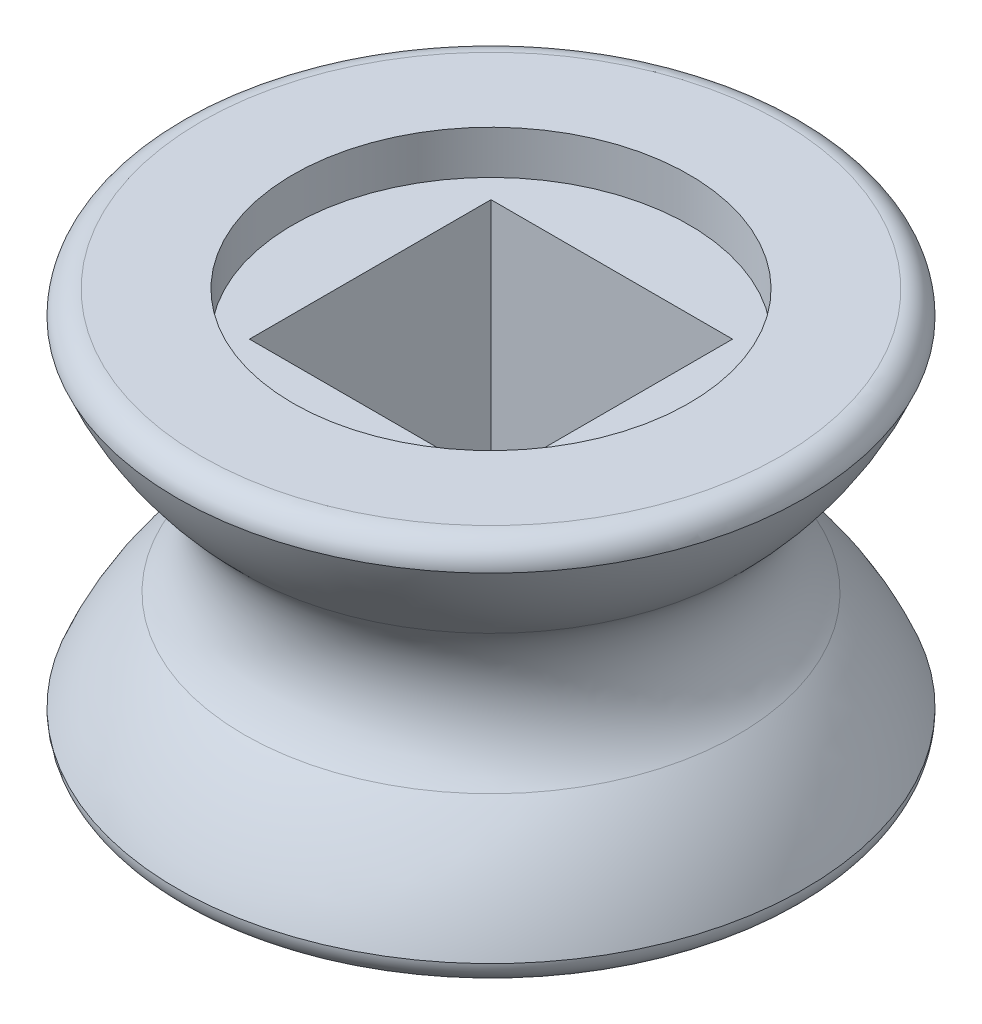
from build123d import *

# Parameters (mm, degrees)
SKETCH3_W          = 6.35
SKETCH3_H          = 6.35
CUT_EXTRUDE2_DEPTH = 16.476293161
SKETCH4_R          = 5.207
CUT_EXTRUDE3_DEPTH = 1.143
FILLET1_R          = 0.635
FILLET2_R          = 7.62


with BuildPart() as part:
    # Sketch1 → Revolve1 (revolve)
    with BuildSketch(Plane.XY, mode=Mode.PRIVATE) as revolve1_sk:
        with BuildLine():
            Line((8.255, -2.54), (8.255, -5.08))
            Line((8.255, -5.08), (0, -5.08))
            Line((0, -5.08), (0, 5.08))
            Line((0, 5.08), (8.255, 5.08))
            Line((8.255, 5.08), (8.255, 2.54))
            ThreePointArc((8.255, 2.54), (5.715, 0), (8.255, -2.54))
        make_face()
    revolve(revolve1_sk.sketch.rotate(Axis((0, -5.08, 0), (0, 1, 0)), 90), axis=Axis((0, -5.08, 0), (0, 1, 0)))

    # Sketch3 → Cut-Extrude2 (cut, through all)
    with BuildSketch(Plane(origin=(0, 5.08, 0), x_dir=(1, 0, 0), z_dir=(0, 1, 0))):
        Rectangle(SKETCH3_W, SKETCH3_H)
    extrude(amount=-CUT_EXTRUDE2_DEPTH, mode=Mode.SUBTRACT)

    # Sketch4 → Cut-Extrude3 (cut)
    with BuildSketch(Plane(origin=(0, 5.08, 0), x_dir=(1, 0, 0), z_dir=(0, 1, 0))):
        with Locations(Location((0, 0, 0), (0, 0, 270))):
            Circle(SKETCH4_R)
    cut_extrude3 = extrude(amount=-CUT_EXTRUDE3_DEPTH, mode=Mode.SUBTRACT)

    # Mirror1: Cut-Extrude3 across plane
    add(cut_extrude3.mirror(Plane.ZX), mode=Mode.SUBTRACT)

    # Fillet1
    fillet1_edges = [part.edges().sort_by_distance(p)[0] for p in [
        (0, 5.08, 8.255),
        (0, -5.08, 8.255),
    ]]
    fillet(fillet1_edges, radius=FILLET1_R)

    # Fillet2
    # the kernel refuses this fillet: 7.62 mm, written as the material it takes off along each edge
    with BuildSketch(Plane(origin=(0, 2.54, 0), x_dir=(0, 0, -1), z_dir=(1, 0, 0))) as fillet2_piece_1:
        with BuildLine():
            CenterArc((1.191070941, 4.7625), FILLET2_R, 314.048625674, 23.927061489)
            Line((8.255, 1.905), (8.396278581, 1.84785))
            ThreePointArc((8.396278581, 1.84785), (8.4074, 0.9525), (8.4074, 0))
            Line((8.4074, 0), (8.255, -0.1524))
            ThreePointArc((8.255, -0.1524), (7.35965, -0.326635562), (6.594976671, -0.8239125))
            Line((6.594976671, -0.8239125), (6.489017735, -0.714375))
        make_face()
    revolve(axis=Axis((0, 2.54, 0), (0, 1, 0)), mode=Mode.SUBTRACT)
    with BuildSketch(Plane(origin=(0, -2.54, 0), x_dir=(0, 0, -1), z_dir=(1, 0, 0))) as fillet2_piece_2:
        with BuildLine():
            CenterArc((1.191070941, -4.7625), FILLET2_R, 22.024312837, 23.927061489)
            Line((6.489017735, 0.714375), (6.594976671, 0.8239125))
            ThreePointArc((6.594976671, 0.8239125), (7.35965, 0.326635562), (8.255, 0.1524))
            Line((8.255, 0.1524), (8.4074, 0))
            ThreePointArc((8.4074, 0), (8.4074, -0.9525), (8.396278581, -1.84785))
            Line((8.396278581, -1.84785), (8.255, -1.905))
        make_face()
    revolve(axis=Axis((0, -2.54, 0), (0, 1, 0)), mode=Mode.SUBTRACT)


solid = part.part
